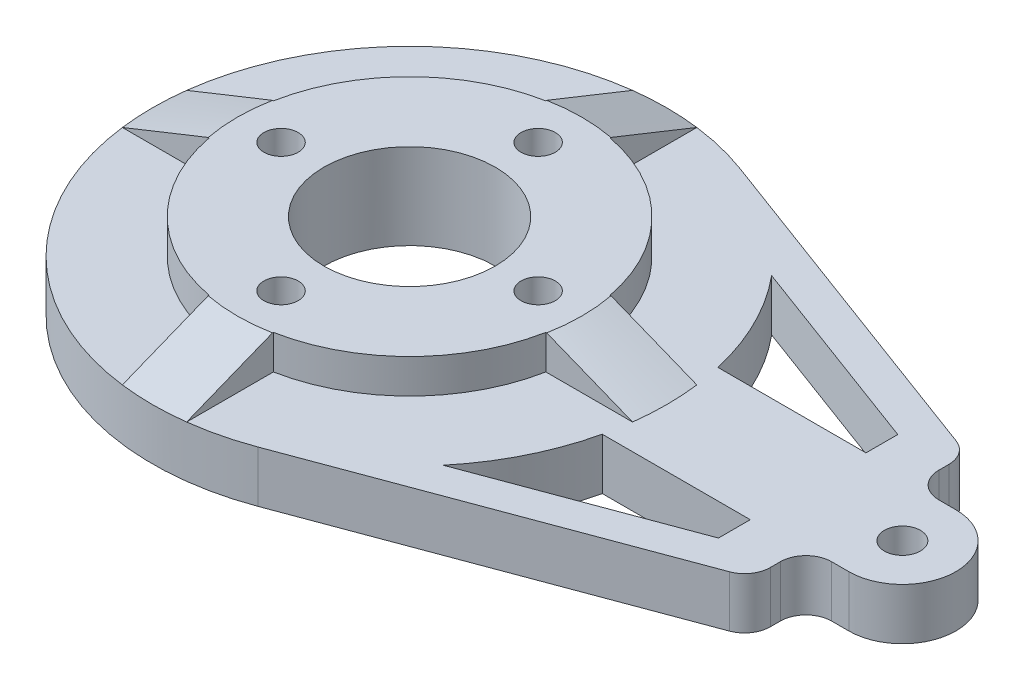
from build123d import *
from OCP.BRepFilletAPI import BRepFilletAPI_MakeChamfer
from build123d.topology import SkipClean

# Parameters (mm, degrees)
SKETCH1_R           = 40
SKETCH1_R_2         = 20
BOSS_EXTRUDE1_DEPTH = 8
BOSS_EXTRUDE2_START = 12
SKETCH3_R           = 20
BOSS_EXTRUDE2_DEPTH = 12
SKETCH5_R           = 7.5
CUT_EXTRUDE3_DEPTH  = 10
SKETCH2_R           = 4
CUT_EXTRUDE1_DEPTH  = 20
BOSS_EXTRUDE3_DEPTH = 8
CHAMFER1_SIZE       = 19.800694827
CHAMFER1_SIZE_2     = 8
BOSS_EXTRUDE4_DEPTH = 12
FILLET1_R           = 6
CUT_EXTRUDE4_DEPTH  = 6
SKETCH9_R           = 4.2
CUT_EXTRUDE5_DEPTH  = 6
CUT_EXTRUDE7_START  = -12
CUT_EXTRUDE7_DEPTH  = 12


with BuildPart() as part:
    # Sketch1 → Boss-Extrude1 (new body)
    with BuildSketch(Plane(origin=(0, 0, 0), x_dir=(1, 0, 0), z_dir=(0, 1, 0))):
        with Locations(Location((0, 0, 0), (0, 0, 270))):
            Circle(SKETCH1_R)
        with Locations(Location((0, 0, 0), (0, 0, 270))):
            Circle(SKETCH1_R_2, mode=Mode.SUBTRACT)
    extrude(amount=BOSS_EXTRUDE1_DEPTH)

    # Sketch3 → Boss-Extrude2 (add)
    with SkipClean():  # the faces are left unmerged after this step: merging them gives an invalid solid
        with BuildSketch(Plane.XZ.offset(BOSS_EXTRUDE2_START)):
            with BuildLine():
                Line((20.894189842, 56.244402662), (105, 25))
                Line((105, 25), (105, -25))
                Line((105, -25), (20.894189842, -56.244402662))
                ThreePointArc((20.894189842, -56.244402662), (-60, 0), (20.894189842, 56.244402662))
            make_face()
            with Locations(Location((0, 0, 0), (0, 0, 270))):
                Circle(SKETCH3_R, mode=Mode.SUBTRACT)
        extrude(amount=-BOSS_EXTRUDE2_DEPTH)

    # Sketch5 → Cut-Extrude3 (cut)
    with SkipClean():  # the faces are left unmerged after this step: merging them gives an invalid solid
        with BuildSketch(Plane.XZ.offset(12)):
            with Locations(Location((0, 30, 0), (0, 0, 270))):
                Circle(SKETCH5_R)
            with Locations(Location((30, 0, 0), (0, 0, 270))):
                Circle(SKETCH5_R)
            with Locations(Location((0, -30, 0), (0, 0, 270))):
                Circle(SKETCH5_R)
            with Locations(Location((-30, 0, 0), (0, 0, 270))):
                Circle(SKETCH5_R)
        extrude(amount=-CUT_EXTRUDE3_DEPTH, mode=Mode.SUBTRACT)

    # Sketch2 → Cut-Extrude1 (cut)
    with SkipClean():  # the faces are left unmerged after this step: merging them gives an invalid solid
        with BuildSketch(Plane(origin=(0, 8, 0), x_dir=(1, 0, 0), z_dir=(0, 1, 0))):
            with Locations(Location((30, 0, 0), (0, 0, 270))):
                Circle(SKETCH2_R)
            with Locations(Location((0, -30, 0), (0, 0, 270))):
                Circle(SKETCH2_R)
            with Locations(Location((-30, 0, 0), (0, 0, 270))):
                Circle(SKETCH2_R)
            with Locations(Location((0, 30, 0), (0, 0, 270))):
                Circle(SKETCH2_R)
        extrude(amount=-CUT_EXTRUDE1_DEPTH, mode=Mode.SUBTRACT)

    # Sketch6 → Boss-Extrude3 (add)
    with SkipClean():  # the faces are left unmerged after this step: merging them gives an invalid solid
        with BuildSketch(Plane(origin=(0, 0, 0), x_dir=(1, 0, 0), z_dir=(0, 1, 0))):
            with BuildLine():
                Line((-7.5, -39.290584114), (-7.5, -59.529404499))
                ThreePointArc((-7.5, -59.529404499), (0, -60), (7.5, -59.529404499))
                Line((7.5, -59.529404499), (7.5, -39.290584114))
                ThreePointArc((7.5, -39.290584114), (0, -40), (-7.5, -39.290584114))
            make_face()
            with BuildLine():
                Line((-39.290584114, -7.5), (-59.529404499, -7.5))
                ThreePointArc((-59.529404499, -7.5), (-60, 0), (-59.529404499, 7.5))
                Line((-59.529404499, 7.5), (-39.290584114, 7.5))
                ThreePointArc((-39.290584114, 7.5), (-40, 0), (-39.290584114, -7.5))
            make_face()
            with BuildLine():
                Line((-7.5, 39.290584114), (-7.5, 59.529404499))
                ThreePointArc((-7.5, 59.529404499), (0, 60), (7.5, 59.529404499))
                Line((7.5, 59.529404499), (7.5, 39.290584114))
                ThreePointArc((7.5, 39.290584114), (0, 40), (-7.5, 39.290584114))
            make_face()
            with BuildLine():
                Line((39.290584114, 7.5), (59.529404499, 7.5))
                ThreePointArc((59.529404499, 7.5), (60, 0), (59.529404499, -7.5))
                Line((59.529404499, -7.5), (39.290584114, -7.5))
                ThreePointArc((39.290584114, -7.5), (40, 0), (39.290584114, 7.5))
            make_face()
        extrude(amount=BOSS_EXTRUDE3_DEPTH)

    # Chamfer1
    chamfer1_edges_1 = [part.edges().sort_by_distance(p)[0] for p in [
        (0, 8, -60),
    ]]
    chamfer1_side_1 = [part.faces().sort_by_distance(p)[0] for p in [
        (0, 8, -59.84),
    ]]
    chamfer1_edges_2 = [part.edges().sort_by_distance(p)[0] for p in [
        (60, 8, 0),
    ]]
    chamfer1_side_2 = [part.faces().sort_by_distance(p)[0] for p in [
        (60, 7.84, 0),
    ]]
    chamfer1_edges_3 = [part.edges().sort_by_distance(p)[0] for p in [
        (0, 8, 60),
    ]]
    chamfer1_side_3 = [part.faces().sort_by_distance(p)[0] for p in [
        (0, 8, 59.84),
    ]]
    chamfer1_edges_4 = [part.edges().sort_by_distance(p)[0] for p in [
        (-60, 8, 0),
    ]]
    chamfer1_side_4 = [part.faces().sort_by_distance(p)[0] for p in [
        (-59.84, 8, 0),
    ]]
    chamfer1 = BRepFilletAPI_MakeChamfer(part.part.solid().wrapped)
    for e in chamfer1_edges_1:
        chamfer1.Add(CHAMFER1_SIZE - 0.0001, CHAMFER1_SIZE_2 - 0.0001, e.wrapped, chamfer1_side_1[0].wrapped)
    for e in chamfer1_edges_2:
        chamfer1.Add(CHAMFER1_SIZE_2 - 0.0001, CHAMFER1_SIZE - 0.0001, e.wrapped, chamfer1_side_2[0].wrapped)
    for e in chamfer1_edges_3:
        chamfer1.Add(CHAMFER1_SIZE - 0.0001, CHAMFER1_SIZE_2 - 0.0001, e.wrapped, chamfer1_side_3[0].wrapped)
    for e in chamfer1_edges_4:
        chamfer1.Add(CHAMFER1_SIZE - 0.0001, CHAMFER1_SIZE_2 - 0.0001, e.wrapped, chamfer1_side_4[0].wrapped)
    add(Compound.cast(chamfer1.Shape()), mode=Mode.REPLACE)  # a hair under: the kernel refuses the full size

    # Sketch7 → Boss-Extrude4 (add)
    with BuildSketch(Plane.XZ.offset(12)):
        with BuildLine():
            Line((115, 12.5), (105, 12.5))
            Line((105, 12.5), (105, -12.5))
            Line((105, -12.5), (115, -12.5))
            ThreePointArc((115, -12.5), (127.5, 0), (115, 12.5))
        make_face()
    extrude(amount=-BOSS_EXTRUDE4_DEPTH)

    # Fillet1
    fillet1_edges = [part.edges().sort_by_distance(p)[0] for p in [
        (105, -6, -25),
        (105, -6, 25),
        (105, -6, -12.5),
        (105, -6, 12.5),
    ]]
    fillet(fillet1_edges, radius=FILLET1_R)

    # Sketch8 → Cut-Extrude4 (cut)
    with BuildSketch(Plane.XZ.offset(12)):
        Polygon((111.24722325, -6.5), (118.75277675, -6.5), (122.505553499, 0), (118.75277675, 6.5), (111.24722325, 6.5), (107.494446501, 0), align=None)
    extrude(amount=-CUT_EXTRUDE4_DEPTH, mode=Mode.SUBTRACT)

    # Sketch9 → Cut-Extrude5 (cut)
    with BuildSketch(Plane.XZ.offset(6)):
        with Locations(Location((115, 0, 0), (0, 0, 270))):
            Circle(SKETCH9_R)
    extrude(amount=-CUT_EXTRUDE5_DEPTH, mode=Mode.SUBTRACT)

    # Sketch11 → Cut-Extrude7 (cut)
    with BuildSketch(Plane(origin=(0, 0, 0), x_dir=(1, 0, 0), z_dir=(0, 1, 0)).offset(CUT_EXTRUDE7_START)):
        with BuildLine():
            Line((93, 20.923688206), (93, 13.5))
            Line((93, 13.5), (58.46152581, 13.5))
            ThreePointArc((58.46152581, 13.5), (53.766674065, 26.62977206), (46.167935821, 38.321295672))
            Line((46.167935821, 38.321295672), (93, 20.923688206))
        make_face()
    cut_extrude7 = extrude(amount=CUT_EXTRUDE7_DEPTH, mode=Mode.SUBTRACT)

    # Mirror1: Cut-Extrude7 across plane
    add(cut_extrude7.mirror(Plane.XY), mode=Mode.SUBTRACT)


solid = part.part
